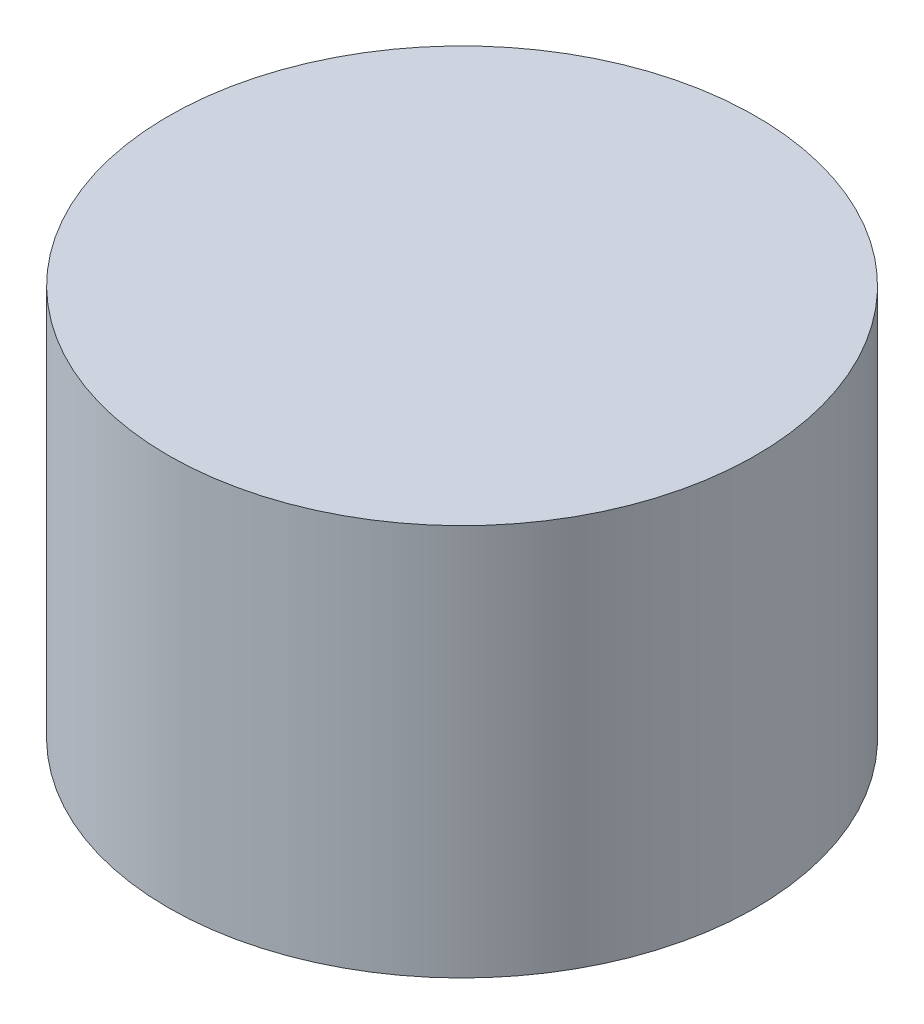
from build123d import *

# Parameters (mm, degrees)
SKETCH1_R           = 24
BOSS_EXTRUDE1_DEPTH = 32


with BuildPart() as part:
    # Sketch1 → Boss-Extrude1 (new body)
    with BuildSketch(Plane(origin=(0, 0, 0), x_dir=(1, 0, 0), z_dir=(0, 1, 0))):
        Circle(SKETCH1_R)
    extrude(amount=BOSS_EXTRUDE1_DEPTH)


solid = part.part
